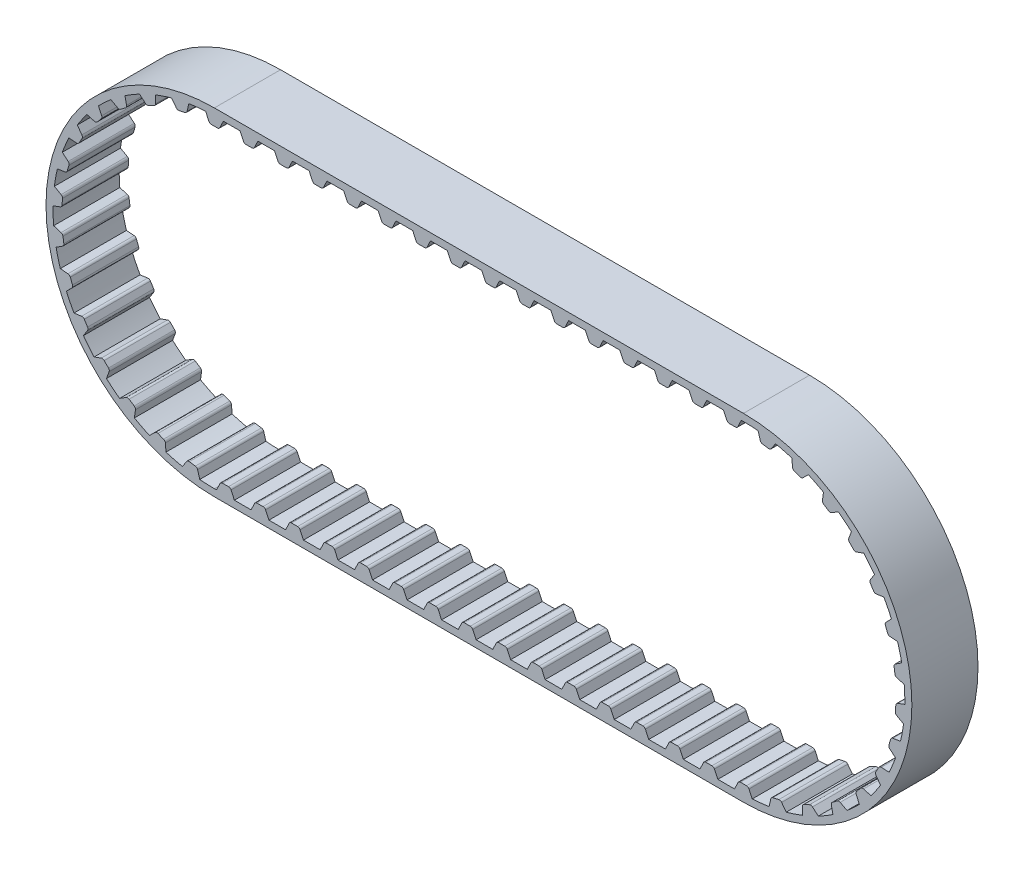
from build123d import *

# Parameters (mm, degrees)
BOSS_EXTRUDE1_DEPTH      = 4.7625
BOSS_EXTRUDE1_DEPTH_BACK = 4.7625
BOSS_EXTRUDE2_DEPTH      = 4.7625
FILLET1_R                = 0.396875
CRVPATTERN1_START        = -4.7625
CRVPATTERN1_DEPTH        = 9.525


# Read off the part's stored shape, not the designer's step: CrvPattern1
with BuildPart() as part:
    # Sketch4 → Boss-Extrude1 (new, two sides: drawn at the far end of the back side and taken through both)
    with BuildSketch(Plane.XY.offset(-BOSS_EXTRUDE1_DEPTH_BACK)):
        with BuildLine():
            Line((-38.1, -24.255213327), (38.1, -24.255213327))
            ThreePointArc((38.1, -24.255213327), (62.355213327, 0), (38.1, 24.255213327))
            Line((38.1, 24.255213327), (-38.1, 24.255213327))
            ThreePointArc((-38.1, 24.255213327), (-62.355213327, 0), (-38.1, -24.255213327))
        make_face()
        with BuildLine():
            Line((-38.1, -23.239213327), (38.1, -23.239213327))
            ThreePointArc((38.1, -23.239213327), (61.339213327, 0), (38.1, 23.239213327))
            Line((38.1, 23.239213327), (-38.1, 23.239213327))
            ThreePointArc((-38.1, 23.239213327), (-61.339213327, 0), (-38.1, -23.239213327))
        make_face(mode=Mode.SUBTRACT)
    extrude(amount=BOSS_EXTRUDE1_DEPTH + BOSS_EXTRUDE1_DEPTH_BACK)

    # Sketch5 → Boss-Extrude2 (add, symmetric)
    with BuildSketch(Plane.XY):
        Polygon((-39.3827, 23.239213327), (-38.790489274, 21.969213327), (-37.409510726, 21.969213327), (-36.8173, 23.239213327), align=None)
    extrude(amount=BOSS_EXTRUDE2_DEPTH, both=True)

    # Fillet1
    fillet1_edges = [part.edges().sort_by_distance(p)[0] for p in [
        (-38.790489274, 21.969213327, 0),
        (-37.409510726, 21.969213327, 0),
    ]]
    fillet(fillet1_edges, radius=FILLET1_R)

    # CrvPattern1 outline → CrvPattern1 (add)
    with BuildSketch(Plane.XY.offset(CRVPATTERN1_START)):
        with BuildLine():
            Line((-32.329052354, 22.198361705), (-31.843695271, 23.239213327))
            Line((-31.843695271, 23.239213327), (-34.409095271, 23.239213327))
            Line((-34.409095271, 23.239213327), (-33.923738189, 22.198361705))
            ThreePointArc((-33.923738189, 22.198361705), (-33.777288068, 22.031367347), (-33.564047286, 21.969213327))
            Line((-33.564047286, 21.969213327), (-32.688743257, 21.969213327))
            ThreePointArc((-32.688743257, 21.969213327), (-32.475502475, 22.031367347), (-32.329052354, 22.198361705))
        make_face()
        with BuildLine():
            Line((-27.355447625, 22.198361705), (-26.870090542, 23.239213327))
            Line((-26.870090542, 23.239213327), (-29.435490542, 23.239213327))
            Line((-29.435490542, 23.239213327), (-28.95013346, 22.198361705))
            ThreePointArc((-28.95013346, 22.198361705), (-28.803683339, 22.031367347), (-28.590442557, 21.969213327))
            Line((-28.590442557, 21.969213327), (-27.715138528, 21.969213327))
            ThreePointArc((-27.715138528, 21.969213327), (-27.501897746, 22.031367347), (-27.355447625, 22.198361705))
        make_face()
        with BuildLine():
            Line((-22.381842896, 22.198361705), (-21.896485814, 23.239213327))
            Line((-21.896485814, 23.239213327), (-24.461885814, 23.239213327))
            Line((-24.461885814, 23.239213327), (-23.976528731, 22.198361705))
            ThreePointArc((-23.976528731, 22.198361705), (-23.83007861, 22.031367347), (-23.616837828, 21.969213327))
            Line((-23.616837828, 21.969213327), (-22.741533799, 21.969213327))
            ThreePointArc((-22.741533799, 21.969213327), (-22.528293017, 22.031367347), (-22.381842896, 22.198361705))
        make_face()
        with BuildLine():
            Line((-17.408238167, 22.198361705), (-16.922881085, 23.239213327))
            Line((-16.922881085, 23.239213327), (-19.488281085, 23.239213327))
            Line((-19.488281085, 23.239213327), (-19.002924002, 22.198361705))
            ThreePointArc((-19.002924002, 22.198361705), (-18.856473881, 22.031367347), (-18.643233099, 21.969213327))
            Line((-18.643233099, 21.969213327), (-17.76792907, 21.969213327))
            ThreePointArc((-17.76792907, 21.969213327), (-17.554688288, 22.031367347), (-17.408238167, 22.198361705))
        make_face()
        with BuildLine():
            Line((-12.434633439, 22.198361705), (-11.949276356, 23.239213327))
            Line((-11.949276356, 23.239213327), (-14.514676356, 23.239213327))
            Line((-14.514676356, 23.239213327), (-14.029319273, 22.198361705))
            ThreePointArc((-14.029319273, 22.198361705), (-13.882869152, 22.031367347), (-13.66962837, 21.969213327))
            Line((-13.66962837, 21.969213327), (-12.794324342, 21.969213327))
            ThreePointArc((-12.794324342, 21.969213327), (-12.58108356, 22.031367347), (-12.434633439, 22.198361705))
        make_face()
        with BuildLine():
            Line((-7.46102871, 22.198361705), (-6.975671627, 23.239213327))
            Line((-6.975671627, 23.239213327), (-9.541071627, 23.239213327))
            Line((-9.541071627, 23.239213327), (-9.055714545, 22.198361705))
            ThreePointArc((-9.055714545, 22.198361705), (-8.909264424, 22.031367347), (-8.696023642, 21.969213327))
            Line((-8.696023642, 21.969213327), (-7.820719613, 21.969213327))
            ThreePointArc((-7.820719613, 21.969213327), (-7.607478831, 22.031367347), (-7.46102871, 22.198361705))
        make_face()
        with BuildLine():
            Line((-2.487423981, 22.198361705), (-2.002066898, 23.239213327))
            Line((-2.002066898, 23.239213327), (-4.567466898, 23.239213327))
            Line((-4.567466898, 23.239213327), (-4.082109816, 22.198361705))
            ThreePointArc((-4.082109816, 22.198361705), (-3.935659695, 22.031367347), (-3.722418913, 21.969213327))
            Line((-3.722418913, 21.969213327), (-2.847114884, 21.969213327))
            ThreePointArc((-2.847114884, 21.969213327), (-2.633874102, 22.031367347), (-2.487423981, 22.198361705))
        make_face()
        with BuildLine():
            Line((2.486180748, 22.198361705), (2.97153783, 23.239213327))
            Line((2.97153783, 23.239213327), (0.40613783, 23.239213327))
            Line((0.40613783, 23.239213327), (0.891494913, 22.198361705))
            ThreePointArc((0.891494913, 22.198361705), (1.037945034, 22.031367347), (1.251185816, 21.969213327))
            Line((1.251185816, 21.969213327), (2.126489845, 21.969213327))
            ThreePointArc((2.126489845, 21.969213327), (2.339730627, 22.031367347), (2.486180748, 22.198361705))
        make_face()
        with BuildLine():
            Line((7.459785477, 22.198361705), (7.945142559, 23.239213327))
            Line((7.945142559, 23.239213327), (5.379742559, 23.239213327))
            Line((5.379742559, 23.239213327), (5.865099642, 22.198361705))
            ThreePointArc((5.865099642, 22.198361705), (6.011549763, 22.031367347), (6.224790545, 21.969213327))
            Line((6.224790545, 21.969213327), (7.100094574, 21.969213327))
            ThreePointArc((7.100094574, 21.969213327), (7.313335356, 22.031367347), (7.459785477, 22.198361705))
        make_face()
        with BuildLine():
            Line((12.433390205, 22.198361705), (12.918747288, 23.239213327))
            Line((12.918747288, 23.239213327), (10.353347288, 23.239213327))
            Line((10.353347288, 23.239213327), (10.838704371, 22.198361705))
            ThreePointArc((10.838704371, 22.198361705), (10.985154492, 22.031367347), (11.198395274, 21.969213327))
            Line((11.198395274, 21.969213327), (12.073699302, 21.969213327))
            ThreePointArc((12.073699302, 21.969213327), (12.286940084, 22.031367347), (12.433390205, 22.198361705))
        make_face()
        with BuildLine():
            Line((17.406994934, 22.198361705), (17.892352017, 23.239213327))
            Line((17.892352017, 23.239213327), (15.326952017, 23.239213327))
            Line((15.326952017, 23.239213327), (15.812309099, 22.198361705))
            ThreePointArc((15.812309099, 22.198361705), (15.95875922, 22.031367347), (16.172000002, 21.969213327))
            Line((16.172000002, 21.969213327), (17.047304031, 21.969213327))
            ThreePointArc((17.047304031, 21.969213327), (17.260544813, 22.031367347), (17.406994934, 22.198361705))
        make_face()
        with BuildLine():
            Line((22.380599663, 22.198361705), (22.865956746, 23.239213327))
            Line((22.865956746, 23.239213327), (20.300556746, 23.239213327))
            Line((20.300556746, 23.239213327), (20.785913828, 22.198361705))
            ThreePointArc((20.785913828, 22.198361705), (20.932363949, 22.031367347), (21.145604731, 21.969213327))
            Line((21.145604731, 21.969213327), (22.02090876, 21.969213327))
            ThreePointArc((22.02090876, 21.969213327), (22.234149542, 22.031367347), (22.380599663, 22.198361705))
        make_face()
        with BuildLine():
            Line((27.354204392, 22.198361705), (27.839561474, 23.239213327))
            Line((27.839561474, 23.239213327), (25.274161474, 23.239213327))
            Line((25.274161474, 23.239213327), (25.759518557, 22.198361705))
            ThreePointArc((25.759518557, 22.198361705), (25.905968678, 22.031367347), (26.11920946, 21.969213327))
            Line((26.11920946, 21.969213327), (26.994513489, 21.969213327))
            ThreePointArc((26.994513489, 21.969213327), (27.207754271, 22.031367347), (27.354204392, 22.198361705))
        make_face()
        with BuildLine():
            Line((32.327809121, 22.198361705), (32.813166203, 23.239213327))
            Line((32.813166203, 23.239213327), (30.247766203, 23.239213327))
            Line((30.247766203, 23.239213327), (30.733123286, 22.198361705))
            ThreePointArc((30.733123286, 22.198361705), (30.879573407, 22.031367347), (31.092814189, 21.969213327))
            Line((31.092814189, 21.969213327), (31.968118218, 21.969213327))
            ThreePointArc((31.968118218, 21.969213327), (32.181359, 22.031367347), (32.327809121, 22.198361705))
        make_face()
        with BuildLine():
            ThreePointArc((-41.790690989, 22.944276761), (-43.035723415, 22.709021785), (-44.266083313, 22.406259229))
            Line((-44.266083313, 22.406259229), (-43.593811237, 21.522570855))
            ThreePointArc((-43.593811237, 21.522570855), (-43.415234755, 21.3904906), (-43.193658209, 21.375044317))
            Line((-43.193658209, 21.375044317), (-42.338323824, 21.560948139))
            ThreePointArc((-42.338323824, 21.560948139), (-42.143148778, 21.666973867), (-42.035507397, 21.861262535))
            Line((-42.035507397, 21.861262535), (-41.790690989, 22.944276761))
        make_face()
        with BuildLine():
            ThreePointArc((-46.579572149, 21.63695663), (-47.746234489, 21.142639292), (-48.884221267, 20.585470792))
            Line((-48.884221267, 20.585470792), (-48.039602202, 19.864725675))
            ThreePointArc((-48.039602202, 19.864725675), (-47.837047634, 19.77358622), (-47.617245651, 19.805552472))
            Line((-47.617245651, 19.805552472), (-46.820908998, 20.168877503))
            ThreePointArc((-46.820908998, 20.168877503), (-46.65270534, 20.313937087), (-46.588784272, 20.526654859))
            Line((-46.588784272, 20.526654859), (-46.579572149, 21.63695663))
        make_face()
        with BuildLine():
            ThreePointArc((-50.981538541, 19.342362857), (-52.016597107, 18.611538384), (-53.010285516, 17.825387006))
            Line((-53.010285516, 17.825387006), (-52.031858623, 17.300472057))
            ThreePointArc((-52.031858623, 17.300472057), (-51.81456834, 17.254432006), (-51.606570273, 17.332352205))
            Line((-51.606570273, 17.332352205), (-50.905567433, 17.856520272))
            ThreePointArc((-50.905567433, 17.856520272), (-50.772010135, 18.033994781), (-50.754726036, 18.255435548))
            Line((-50.754726036, 18.255435548), (-50.981538541, 19.342362857))
        make_face()
        with BuildLine():
            ThreePointArc((-54.795732645, 16.165195561), (-55.651958705, 15.231210776), (-56.456007693, 14.251947854))
            Line((-56.456007693, 14.251947854), (-55.388417656, 13.946814441))
            ThreePointArc((-55.388417656, 13.946814441), (-55.166306406, 13.947974559), (-54.979603008, 14.06829328))
            Line((-54.979603008, 14.06829328), (-54.405920071, 14.729387093))
            ThreePointArc((-54.405920071, 14.729387093), (-54.313103224, 14.931178536), (-54.343244752, 15.151238168))
            Line((-54.343244752, 15.151238168), (-54.795732645, 16.165195561))
        make_face()
        with BuildLine():
            ThreePointArc((-57.848116432, 12.250425847), (-58.48644121, 11.155897582), (-59.064162791, 10.028205949))
            Line((-59.064162791, 10.028205949), (-57.956122721, 9.956777017))
            ThreePointArc((-57.956122721, 9.956777017), (-57.739325228, 10.005084368), (-57.582435597, 10.162311583))
            Line((-57.582435597, 10.162311583), (-57.162249166, 10.930166066))
            ThreePointArc((-57.162249166, 10.930166066), (-57.114407915, 11.147066891), (-57.190599741, 11.355704277))
            Line((-57.190599741, 11.355704277), (-57.848116432, 12.250425847))
        make_face()
        with BuildLine():
            ThreePointArc((-59.999412549, 7.776680916), (-60.390709895, 6.571551449), (-60.715743185, 5.346886595))
            Line((-60.715743185, 5.346886595), (-59.617811893, 5.512421378))
            ThreePointArc((-59.617811893, 5.512421378), (-59.416220418, 5.605671744), (-59.296303278, 5.792633326))
            Line((-59.296303278, 5.792633326), (-59.048786059, 6.632212011))
            ThreePointArc((-59.048786059, 6.632212011), (-59.048103353, 6.854325242), (-59.166868917, 7.042020458))
            Line((-59.166868917, 7.042020458), (-59.999412549, 7.776680916))
        make_face()
        with BuildLine():
            ThreePointArc((-61.151459411, 2.94809347), (-61.277874801, 1.687351707), (-61.335388842, 0.421593918))
            Line((-61.335388842, 0.421593918), (-60.297663881, 0.816539223))
            ThreePointArc((-60.297663881, 0.816539223), (-60.120476852, 0.950477679), (-60.043003907, 1.158642748))
            Line((-60.043003907, 1.158642748), (-59.979449874, 2.031636464))
            ThreePointArc((-59.979449874, 2.031636464), (-60.025956865, 2.248827286), (-60.181877007, 2.407015979))
            Line((-60.181877007, 2.407015979), (-61.151459411, 2.94809347))
        make_face()
        with BuildLine():
            ThreePointArc((-61.25169022, -2.015012663), (-61.107455441, -3.273840281), (-60.894825923, -4.522935687))
            Line((-60.894825923, -4.522935687), (-59.964657692, -3.916600837))
            ThreePointArc((-59.964657692, -3.916600837), (-59.819959983, -3.748085774), (-59.788466249, -3.52821559))
            Line((-59.788466249, -3.52821559), (-59.911775311, -2.661640712))
            ThreePointArc((-59.911775311, -2.661640712), (-60.00334993, -2.459282509), (-60.189310164, -2.337818338))
            Line((-60.189310164, -2.337818338), (-61.25169022, -2.015012663))
        make_face()
        with BuildLine():
            ThreePointArc((-60.295531541, -6.886175694), (-59.887227889, -8.085650067), (-59.414156892, -9.26108806))
            Line((-59.414156892, -9.26108806), (-58.633988078, -8.471030145))
            ThreePointArc((-58.633988078, -8.471030145), (-58.528382107, -8.275627657), (-58.544304614, -8.054084824))
            Line((-58.544304614, -8.054084824), (-58.848850296, -7.233469768))
            ThreePointArc((-58.848850296, -7.233469768), (-58.98131408, -7.055177594), (-59.188829218, -6.97598024))
            Line((-59.188829218, -6.97598024), (-60.295531541, -6.886175694))
        make_face()
        with BuildLine():
            ThreePointArc((-58.32661198, -11.443129112), (-57.672869959, -12.528519371), (-56.960943261, -13.576665841))
            Line((-56.960943261, -13.576665841), (-56.366372221, -12.638934448))
            ThreePointArc((-56.366372221, -12.638934448), (-56.304676688, -12.425560564), (-56.367288907, -12.212453869))
            Line((-56.367288907, -12.212453869), (-56.839175082, -11.475242515))
            ThreePointArc((-56.839175082, -11.475242515), (-57.006483835, -11.329151672), (-57.226085159, -11.295834833))
            Line((-57.226085159, -11.295834833), (-58.32661198, -11.443129112))
        make_face()
        with BuildLine():
            ThreePointArc((-55.434771454, -15.477943491), (-54.565420688, -16.399724316), (-53.647122824, -17.27275334))
            Line((-53.647122824, -17.27275334), (-53.265279266, -16.230136256))
            ThreePointArc((-53.265279266, -16.230136256), (-53.250309278, -16.008527021), (-53.356754273, -15.81358032))
            Line((-53.356754273, -15.81358032), (-53.974449225, -15.193410917))
            ThreePointArc((-53.974449225, -15.193410917), (-54.16896881, -15.086187391), (-54.390636122, -15.100271283))
            Line((-54.390636122, -15.100271283), (-55.434771454, -15.477943491))
        make_face()
        with BuildLine():
            ThreePointArc((-51.751961882, -18.806514107), (-50.706670015, -19.52262552), (-49.623902038, -20.18070162))
            Line((-49.623902038, -20.18070162), (-49.472209118, -19.080772466))
            ThreePointArc((-49.472209118, -19.080772466), (-49.504647742, -18.861039698), (-49.65006853, -18.693148222))
            Line((-49.65006853, -18.693148222), (-50.385387429, -18.218318507))
            ThreePointArc((-50.385387429, -18.218318507), (-50.598242102, -18.154854804), (-50.811860935, -18.215696793))
            Line((-50.811860935, -18.215696793), (-51.751961882, -18.806514107))
        make_face()
        with BuildLine():
            ThreePointArc((-47.446226342, -21.276961466), (-46.272689042, -21.754727989), (-45.07485662, -22.167823781))
            Line((-45.07485662, -22.167823781), (-45.160235941, -21.060771272))
            ThreePointArc((-45.160235941, -21.060771272), (-45.238603034, -20.852941168), (-45.416364203, -20.719765644))
            Line((-45.416364203, -20.719765644), (-46.235755152, -20.411941642))
            ThreePointArc((-46.235755152, -20.411941642), (-46.457232558, -20.395133552), (-46.653055688, -20.499957475))
            Line((-46.653055688, -20.499957475), (-47.446226342, -21.276961466))
        make_face()
        with BuildLine():
            ThreePointArc((-42.71403143, -22.776561418), (-41.465796083, -22.994183021), (-40.207555164, -23.143449339))
            Line((-40.207555164, -23.143449339), (-40.526110949, -22.079787222))
            ThreePointArc((-40.526110949, -22.079787222), (-40.646830695, -21.89334287), (-40.848821173, -21.800959971))
            Line((-40.848821173, -21.800959971), (-41.714896145, -21.674187398))
            ThreePointArc((-41.714896145, -21.674187398), (-41.934890482, -21.704801856), (-42.103982688, -21.848824699))
            Line((-42.103982688, -21.848824699), (-42.71403143, -22.776561418))
        make_face()
        with BuildLine():
            Line((-37.786770932, -23.239213327), (-35.221370932, -23.239213327))
            Line((-35.221370932, -23.239213327), (-35.706728015, -22.198361705))
            ThreePointArc((-35.706728015, -22.198361705), (-35.853178136, -22.031367347), (-36.066418918, -21.969213327))
            Line((-36.066418918, -21.969213327), (-36.941722946, -21.969213327))
            ThreePointArc((-36.941722946, -21.969213327), (-37.154963728, -22.031367347), (-37.301413849, -22.198361705))
            Line((-37.301413849, -22.198361705), (-37.786770932, -23.239213327))
        make_face()
        with BuildLine():
            Line((-32.813166203, -23.239213327), (-30.247766203, -23.239213327))
            Line((-30.247766203, -23.239213327), (-30.733123286, -22.198361705))
            ThreePointArc((-30.733123286, -22.198361705), (-30.879573407, -22.031367347), (-31.092814189, -21.969213327))
            Line((-31.092814189, -21.969213327), (-31.968118218, -21.969213327))
            ThreePointArc((-31.968118218, -21.969213327), (-32.181359, -22.031367347), (-32.327809121, -22.198361705))
            Line((-32.327809121, -22.198361705), (-32.813166203, -23.239213327))
        make_face()
        with BuildLine():
            Line((-27.839561474, -23.239213327), (-25.274161474, -23.239213327))
            Line((-25.274161474, -23.239213327), (-25.759518557, -22.198361705))
            ThreePointArc((-25.759518557, -22.198361705), (-25.905968678, -22.031367347), (-26.11920946, -21.969213327))
            Line((-26.11920946, -21.969213327), (-26.994513489, -21.969213327))
            ThreePointArc((-26.994513489, -21.969213327), (-27.207754271, -22.031367347), (-27.354204392, -22.198361705))
            Line((-27.354204392, -22.198361705), (-27.839561474, -23.239213327))
        make_face()
        with BuildLine():
            Line((-22.865956746, -23.239213327), (-20.300556746, -23.239213327))
            Line((-20.300556746, -23.239213327), (-20.785913828, -22.198361705))
            ThreePointArc((-20.785913828, -22.198361705), (-20.932363949, -22.031367347), (-21.145604731, -21.969213327))
            Line((-21.145604731, -21.969213327), (-22.02090876, -21.969213327))
            ThreePointArc((-22.02090876, -21.969213327), (-22.234149542, -22.031367347), (-22.380599663, -22.198361705))
            Line((-22.380599663, -22.198361705), (-22.865956746, -23.239213327))
        make_face()
        with BuildLine():
            Line((-17.892352017, -23.239213327), (-15.326952017, -23.239213327))
            Line((-15.326952017, -23.239213327), (-15.812309099, -22.198361705))
            ThreePointArc((-15.812309099, -22.198361705), (-15.95875922, -22.031367347), (-16.172000002, -21.969213327))
            Line((-16.172000002, -21.969213327), (-17.047304031, -21.969213327))
            ThreePointArc((-17.047304031, -21.969213327), (-17.260544813, -22.031367347), (-17.406994934, -22.198361705))
            Line((-17.406994934, -22.198361705), (-17.892352017, -23.239213327))
        make_face()
        with BuildLine():
            Line((-12.918747288, -23.239213327), (-10.353347288, -23.239213327))
            Line((-10.353347288, -23.239213327), (-10.838704371, -22.198361705))
            ThreePointArc((-10.838704371, -22.198361705), (-10.985154492, -22.031367347), (-11.198395274, -21.969213327))
            Line((-11.198395274, -21.969213327), (-12.073699302, -21.969213327))
            ThreePointArc((-12.073699302, -21.969213327), (-12.286940084, -22.031367347), (-12.433390205, -22.198361705))
            Line((-12.433390205, -22.198361705), (-12.918747288, -23.239213327))
        make_face()
        with BuildLine():
            Line((-7.945142559, -23.239213327), (-5.379742559, -23.239213327))
            Line((-5.379742559, -23.239213327), (-5.865099642, -22.198361705))
            ThreePointArc((-5.865099642, -22.198361705), (-6.011549763, -22.031367347), (-6.224790545, -21.969213327))
            Line((-6.224790545, -21.969213327), (-7.100094574, -21.969213327))
            ThreePointArc((-7.100094574, -21.969213327), (-7.313335356, -22.031367347), (-7.459785477, -22.198361705))
            Line((-7.459785477, -22.198361705), (-7.945142559, -23.239213327))
        make_face()
        with BuildLine():
            Line((-2.97153783, -23.239213327), (-0.40613783, -23.239213327))
            Line((-0.40613783, -23.239213327), (-0.891494913, -22.198361705))
            ThreePointArc((-0.891494913, -22.198361705), (-1.037945034, -22.031367347), (-1.251185816, -21.969213327))
            Line((-1.251185816, -21.969213327), (-2.126489845, -21.969213327))
            ThreePointArc((-2.126489845, -21.969213327), (-2.339730627, -22.031367347), (-2.486180748, -22.198361705))
            Line((-2.486180748, -22.198361705), (-2.97153783, -23.239213327))
        make_face()
        with BuildLine():
            Line((2.002066898, -23.239213327), (4.567466898, -23.239213327))
            Line((4.567466898, -23.239213327), (4.082109816, -22.198361705))
            ThreePointArc((4.082109816, -22.198361705), (3.935659695, -22.031367347), (3.722418913, -21.969213327))
            Line((3.722418913, -21.969213327), (2.847114884, -21.969213327))
            ThreePointArc((2.847114884, -21.969213327), (2.633874102, -22.031367347), (2.487423981, -22.198361705))
            Line((2.487423981, -22.198361705), (2.002066898, -23.239213327))
        make_face()
        with BuildLine():
            Line((6.975671627, -23.239213327), (9.541071627, -23.239213327))
            Line((9.541071627, -23.239213327), (9.055714545, -22.198361705))
            ThreePointArc((9.055714545, -22.198361705), (8.909264424, -22.031367347), (8.696023642, -21.969213327))
            Line((8.696023642, -21.969213327), (7.820719613, -21.969213327))
            ThreePointArc((7.820719613, -21.969213327), (7.607478831, -22.031367347), (7.46102871, -22.198361705))
            Line((7.46102871, -22.198361705), (6.975671627, -23.239213327))
        make_face()
        with BuildLine():
            Line((11.949276356, -23.239213327), (14.514676356, -23.239213327))
            Line((14.514676356, -23.239213327), (14.029319273, -22.198361705))
            ThreePointArc((14.029319273, -22.198361705), (13.882869152, -22.031367347), (13.66962837, -21.969213327))
            Line((13.66962837, -21.969213327), (12.794324342, -21.969213327))
            ThreePointArc((12.794324342, -21.969213327), (12.58108356, -22.031367347), (12.434633439, -22.198361705))
            Line((12.434633439, -22.198361705), (11.949276356, -23.239213327))
        make_face()
        with BuildLine():
            Line((16.922881085, -23.239213327), (19.488281085, -23.239213327))
            Line((19.488281085, -23.239213327), (19.002924002, -22.198361705))
            ThreePointArc((19.002924002, -22.198361705), (18.856473881, -22.031367347), (18.643233099, -21.969213327))
            Line((18.643233099, -21.969213327), (17.76792907, -21.969213327))
            ThreePointArc((17.76792907, -21.969213327), (17.554688288, -22.031367347), (17.408238167, -22.198361705))
            Line((17.408238167, -22.198361705), (16.922881085, -23.239213327))
        make_face()
        with BuildLine():
            Line((21.896485814, -23.239213327), (24.461885814, -23.239213327))
            Line((24.461885814, -23.239213327), (23.976528731, -22.198361705))
            ThreePointArc((23.976528731, -22.198361705), (23.83007861, -22.031367347), (23.616837828, -21.969213327))
            Line((23.616837828, -21.969213327), (22.741533799, -21.969213327))
            ThreePointArc((22.741533799, -21.969213327), (22.528293017, -22.031367347), (22.381842896, -22.198361705))
            Line((22.381842896, -22.198361705), (21.896485814, -23.239213327))
        make_face()
        with BuildLine():
            Line((26.870090542, -23.239213327), (29.435490542, -23.239213327))
            Line((29.435490542, -23.239213327), (28.95013346, -22.198361705))
            ThreePointArc((28.95013346, -22.198361705), (28.803683339, -22.031367347), (28.590442557, -21.969213327))
            Line((28.590442557, -21.969213327), (27.715138528, -21.969213327))
            ThreePointArc((27.715138528, -21.969213327), (27.501897746, -22.031367347), (27.355447625, -22.198361705))
            Line((27.355447625, -22.198361705), (26.870090542, -23.239213327))
        make_face()
        with BuildLine():
            Line((31.843695271, -23.239213327), (34.409095271, -23.239213327))
            Line((34.409095271, -23.239213327), (33.923738189, -22.198361705))
            ThreePointArc((33.923738189, -22.198361705), (33.777288068, -22.031367347), (33.564047286, -21.969213327))
            Line((33.564047286, -21.969213327), (32.688743257, -21.969213327))
            ThreePointArc((32.688743257, -21.969213327), (32.475502475, -22.031367347), (32.329052354, -22.198361705))
            Line((32.329052354, -22.198361705), (31.843695271, -23.239213327))
        make_face()
        with BuildLine():
            ThreePointArc((38.1, -23.239213327), (38.733531894, -23.230576261), (39.366592873, -23.204671481))
            Line((39.366592873, -23.204671481), (38.897342917, -22.198361705))
            ThreePointArc((38.897342917, -22.198361705), (38.750892796, -22.031367347), (38.537652014, -21.969213327))
            Line((38.537652014, -21.969213327), (37.662347986, -21.969213327))
            ThreePointArc((37.662347986, -21.969213327), (37.449107204, -22.031367347), (37.302657083, -22.198361705))
            Line((37.302657083, -22.198361705), (36.8173, -23.239213327))
            Line((36.8173, -23.239213327), (38.1, -23.239213327))
        make_face()
        with BuildLine():
            ThreePointArc((41.790690989, -22.944276761), (43.035723415, -22.709021785), (44.266083313, -22.406259229))
            Line((44.266083313, -22.406259229), (43.593811237, -21.522570855))
            ThreePointArc((43.593811237, -21.522570855), (43.415234755, -21.3904906), (43.193658209, -21.375044317))
            Line((43.193658209, -21.375044317), (42.338323824, -21.560948139))
            ThreePointArc((42.338323824, -21.560948139), (42.143148778, -21.666973867), (42.035507397, -21.861262535))
            Line((42.035507397, -21.861262535), (41.790690989, -22.944276761))
        make_face()
        with BuildLine():
            ThreePointArc((46.579572149, -21.63695663), (47.746234489, -21.142639292), (48.884221267, -20.585470792))
            Line((48.884221267, -20.585470792), (48.039602202, -19.864725675))
            ThreePointArc((48.039602202, -19.864725675), (47.837047634, -19.77358622), (47.617245651, -19.805552472))
            Line((47.617245651, -19.805552472), (46.820908998, -20.168877503))
            ThreePointArc((46.820908998, -20.168877503), (46.65270534, -20.313937087), (46.588784272, -20.526654859))
            Line((46.588784272, -20.526654859), (46.579572149, -21.63695663))
        make_face()
        with BuildLine():
            ThreePointArc((50.981538541, -19.342362857), (52.016597107, -18.611538384), (53.010285516, -17.825387006))
            Line((53.010285516, -17.825387006), (52.031858623, -17.300472057))
            ThreePointArc((52.031858623, -17.300472057), (51.81456834, -17.254432006), (51.606570273, -17.332352205))
            Line((51.606570273, -17.332352205), (50.905567433, -17.856520272))
            ThreePointArc((50.905567433, -17.856520272), (50.772010135, -18.033994781), (50.754726036, -18.255435548))
            Line((50.754726036, -18.255435548), (50.981538541, -19.342362857))
        make_face()
        with BuildLine():
            ThreePointArc((54.795732645, -16.165195561), (55.651958705, -15.231210775), (56.456007693, -14.251947854))
            Line((56.456007693, -14.251947854), (55.388417656, -13.946814441))
            ThreePointArc((55.388417656, -13.946814441), (55.166306406, -13.947974559), (54.979603008, -14.06829328))
            Line((54.979603008, -14.06829328), (54.405920071, -14.729387093))
            ThreePointArc((54.405920071, -14.729387093), (54.313103224, -14.931178536), (54.343244752, -15.151238168))
            Line((54.343244752, -15.151238168), (54.795732645, -16.165195561))
        make_face()
        with BuildLine():
            ThreePointArc((57.848116432, -12.250425847), (58.48644121, -11.155897582), (59.064162791, -10.028205949))
            Line((59.064162791, -10.028205949), (57.956122721, -9.956777017))
            ThreePointArc((57.956122721, -9.956777017), (57.739325228, -10.005084368), (57.582435597, -10.162311583))
            Line((57.582435597, -10.162311583), (57.162249166, -10.930166066))
            ThreePointArc((57.162249166, -10.930166066), (57.114407915, -11.147066891), (57.190599741, -11.355704277))
            Line((57.190599741, -11.355704277), (57.848116432, -12.250425847))
        make_face()
        with BuildLine():
            ThreePointArc((59.999412549, -7.776680916), (60.390709895, -6.571551449), (60.715743185, -5.346886595))
            Line((60.715743185, -5.346886595), (59.617811893, -5.512421378))
            ThreePointArc((59.617811893, -5.512421378), (59.416220418, -5.605671744), (59.296303278, -5.792633326))
            Line((59.296303278, -5.792633326), (59.048786059, -6.632212011))
            ThreePointArc((59.048786059, -6.632212011), (59.048103353, -6.854325242), (59.166868917, -7.042020458))
            Line((59.166868917, -7.042020458), (59.999412549, -7.776680916))
        make_face()
        with BuildLine():
            ThreePointArc((61.15145941, -2.94809347), (61.277874801, -1.687351707), (61.335388842, -0.421593918))
            Line((61.335388842, -0.421593918), (60.297663881, -0.816539223))
            ThreePointArc((60.297663881, -0.816539223), (60.120476852, -0.950477679), (60.043003907, -1.158642748))
            Line((60.043003907, -1.158642748), (59.979449874, -2.031636464))
            ThreePointArc((59.979449874, -2.031636464), (60.025956865, -2.248827286), (60.181877007, -2.407015979))
            Line((60.181877007, -2.407015979), (61.15145941, -2.94809347))
        make_face()
        with BuildLine():
            ThreePointArc((61.25169022, 2.015012663), (61.107455441, 3.273840281), (60.894825922, 4.522935687))
            Line((60.894825922, 4.522935687), (59.964657692, 3.916600837))
            ThreePointArc((59.964657692, 3.916600837), (59.819959983, 3.748085774), (59.788466249, 3.52821559))
            Line((59.788466249, 3.52821559), (59.911775311, 2.661640712))
            ThreePointArc((59.911775311, 2.661640712), (60.00334993, 2.459282509), (60.189310164, 2.337818338))
            Line((60.189310164, 2.337818338), (61.25169022, 2.015012663))
        make_face()
        with BuildLine():
            ThreePointArc((60.295531541, 6.886175694), (59.887227888, 8.085650067), (59.414156892, 9.26108806))
            Line((59.414156892, 9.26108806), (58.633988078, 8.471030145))
            ThreePointArc((58.633988078, 8.471030145), (58.528382107, 8.275627657), (58.544304614, 8.054084824))
            Line((58.544304614, 8.054084824), (58.848850296, 7.233469768))
            ThreePointArc((58.848850296, 7.233469768), (58.98131408, 7.055177594), (59.188829218, 6.97598024))
            Line((59.188829218, 6.97598024), (60.295531541, 6.886175694))
        make_face()
        with BuildLine():
            ThreePointArc((58.32661198, 11.443129112), (57.672869959, 12.528519371), (56.960943261, 13.576665841))
            Line((56.960943261, 13.576665841), (56.366372221, 12.638934448))
            ThreePointArc((56.366372221, 12.638934448), (56.304676688, 12.425560564), (56.367288907, 12.212453869))
            Line((56.367288907, 12.212453869), (56.839175082, 11.475242515))
            ThreePointArc((56.839175082, 11.475242515), (57.006483835, 11.329151672), (57.226085159, 11.295834833))
            Line((57.226085159, 11.295834833), (58.32661198, 11.443129112))
        make_face()
        with BuildLine():
            ThreePointArc((55.434771454, 15.477943491), (54.565420688, 16.399724316), (53.647122824, 17.27275334))
            Line((53.647122824, 17.27275334), (53.265279266, 16.230136256))
            ThreePointArc((53.265279266, 16.230136256), (53.250309278, 16.008527021), (53.356754273, 15.81358032))
            Line((53.356754273, 15.81358032), (53.974449225, 15.193410917))
            ThreePointArc((53.974449225, 15.193410917), (54.16896881, 15.086187391), (54.390636122, 15.100271283))
            Line((54.390636122, 15.100271283), (55.434771454, 15.477943491))
        make_face()
        with BuildLine():
            ThreePointArc((51.751961882, 18.806514107), (50.706670015, 19.52262552), (49.623902038, 20.18070162))
            Line((49.623902038, 20.18070162), (49.472209118, 19.080772466))
            ThreePointArc((49.472209118, 19.080772466), (49.504647742, 18.861039698), (49.65006853, 18.693148222))
            Line((49.65006853, 18.693148222), (50.385387429, 18.218318507))
            ThreePointArc((50.385387429, 18.218318507), (50.598242102, 18.154854804), (50.811860935, 18.215696793))
            Line((50.811860935, 18.215696793), (51.751961882, 18.806514107))
        make_face()
        with BuildLine():
            ThreePointArc((47.446226342, 21.276961466), (46.272689042, 21.754727989), (45.07485662, 22.167823781))
            Line((45.07485662, 22.167823781), (45.160235941, 21.060771272))
            ThreePointArc((45.160235941, 21.060771272), (45.238603034, 20.852941168), (45.416364203, 20.719765644))
            Line((45.416364203, 20.719765644), (46.235755152, 20.411941642))
            ThreePointArc((46.235755152, 20.411941642), (46.457232558, 20.395133552), (46.653055688, 20.499957475))
            Line((46.653055688, 20.499957475), (47.446226342, 21.276961466))
        make_face()
        with BuildLine():
            ThreePointArc((42.71403143, 22.776561418), (41.465796083, 22.994183021), (40.207555164, 23.143449339))
            Line((40.207555164, 23.143449339), (40.526110949, 22.079787222))
            ThreePointArc((40.526110949, 22.079787222), (40.646830695, 21.89334287), (40.848821173, 21.800959971))
            Line((40.848821173, 21.800959971), (41.714896145, 21.674187398))
            ThreePointArc((41.714896145, 21.674187398), (41.934890482, 21.704801856), (42.103982688, 21.848824699))
            Line((42.103982688, 21.848824699), (42.71403143, 22.776561418))
        make_face()
        with BuildLine():
            Line((36.066418918, 21.969213327), (36.941722946, 21.969213327))
            ThreePointArc((36.941722946, 21.969213327), (37.154963728, 22.031367347), (37.301413849, 22.198361705))
            Line((37.301413849, 22.198361705), (37.786770932, 23.239213327))
            Line((37.786770932, 23.239213327), (35.221370932, 23.239213327))
            Line((35.221370932, 23.239213327), (35.706728015, 22.198361705))
            ThreePointArc((35.706728015, 22.198361705), (35.853178136, 22.031367347), (36.066418918, 21.969213327))
        make_face()
    extrude(amount=CRVPATTERN1_DEPTH)


solid = part.part
